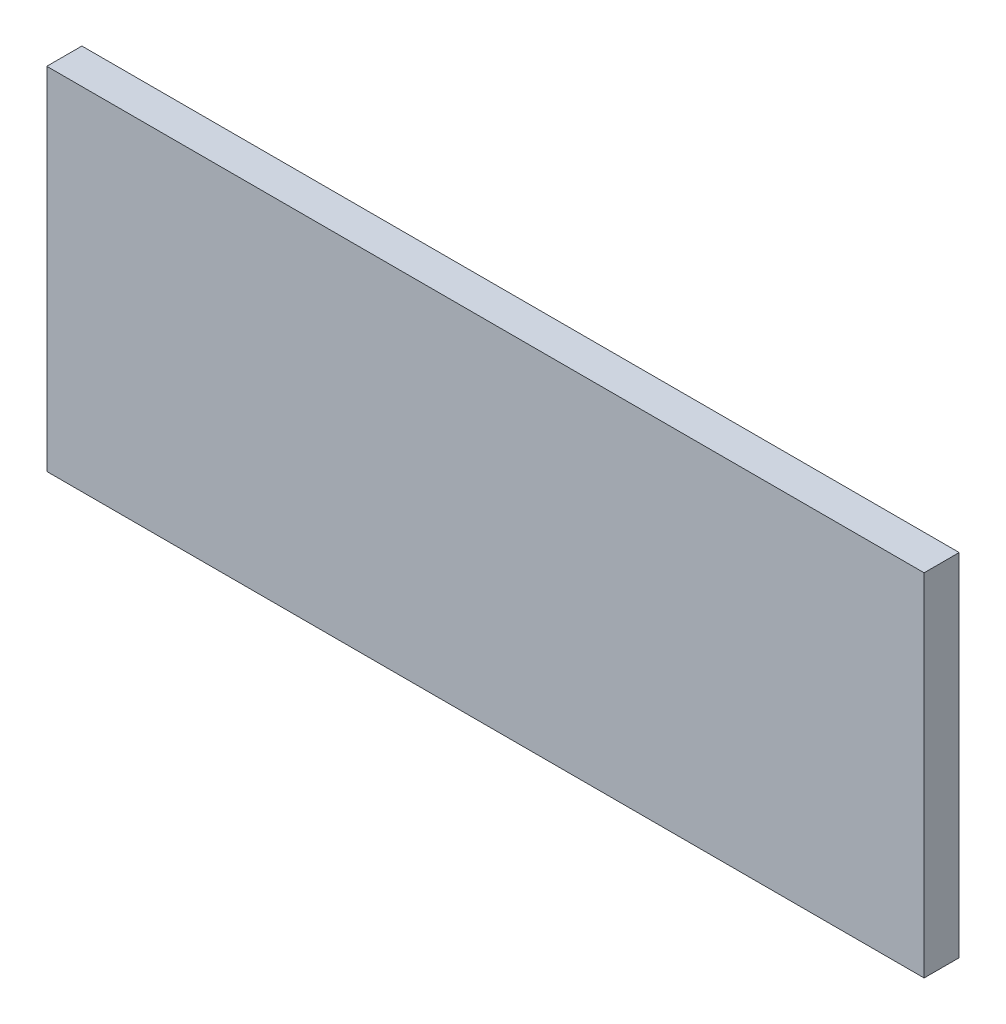
from build123d import *

# Parameters (mm, degrees)
SKETCH_1_W             = 150
SKETCH_1_H             = 60
SM_BASE_FLANGE_1_DEPTH = 6


# Sheet-metal steps are written as plain solids
with BuildPart() as part:
    # Sketch 1 → Базовая кромка1 (new body)
    with BuildSketch(Plane.XY):
        Rectangle(SKETCH_1_W, SKETCH_1_H)
    extrude(amount=-SM_BASE_FLANGE_1_DEPTH)


solid = part.part
